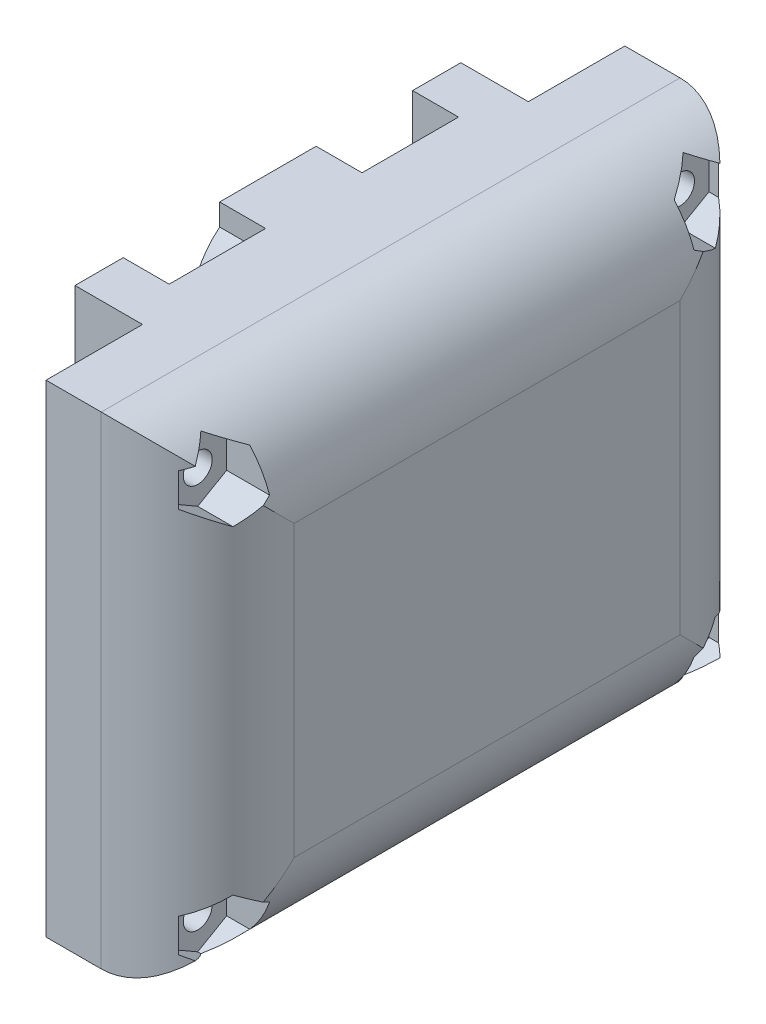
from build123d import *
from build123d.topology import SkipClean

# Parameters (mm, degrees)
CROQUIS1_W              = 60
CROQUIS1_H              = 50
CROQUIS1_R              = 1.5
SALIENTE_EXTRUIR1_DEPTH = 17.96
SALIENTE_EXTRUIR2_START = 4.7625
CROQUIS3_W              = 15
CROQUIS3_H              = 50
CROQUIS3_R              = 1.5
SALIENTE_EXTRUIR2_DEPTH = 4.7625
SALIENTE_EXTRUIR3_DEPTH = 4.7625
REDONDEO2_R             = 10
CORTAR_EXTRUIR1_DEPTH   = 5
CROQUIS6_W              = 10
CROQUIS6_H              = 50
CORTAR_EXTRUIR2_DEPTH   = 7


with BuildPart() as part:
    # Croquis1 → Saliente-Extruir1 (new body)
    with BuildSketch(Plane(origin=(0, 0, 0), x_dir=(0, 0, -1), z_dir=(1, 0, 0))):
        Rectangle(CROQUIS1_W, CROQUIS1_H)
        with Locations((-25, 20)):
            Circle(CROQUIS1_R, mode=Mode.SUBTRACT)
        with Locations(Location((25, 20, 0), (0, 0, 180))):
            Circle(CROQUIS1_R, mode=Mode.SUBTRACT)
        with Locations((25, -20)):
            Circle(CROQUIS1_R, mode=Mode.SUBTRACT)
        with Locations(Location((-25, -20, 0), (0, 0, 180))):
            Circle(CROQUIS1_R, mode=Mode.SUBTRACT)
    extrude(amount=SALIENTE_EXTRUIR1_DEPTH)

    # Croquis3 → Saliente-Extruir2 (add)
    # profile 1 of 2: a face of its own
    with SkipClean():  # the faces are left unmerged after this step: merging them gives an invalid solid
        with BuildSketch(Plane.ZY.offset(SALIENTE_EXTRUIR2_START)):
            with Locations((-22.5, 0)):
                Rectangle(CROQUIS3_W, CROQUIS3_H)
            with Locations((-25, -20)):
                Circle(CROQUIS3_R, mode=Mode.SUBTRACT)
            with Locations((-25, 20)):
                Circle(CROQUIS3_R, mode=Mode.SUBTRACT)
        # profile 2 of 2: a face of its own
        with BuildSketch(Plane.ZY.offset(SALIENTE_EXTRUIR2_START)):
            with Locations((22.5, 0)):
                Rectangle(CROQUIS3_W, CROQUIS3_H)
            with Locations((25, -20)):
                Circle(CROQUIS3_R, mode=Mode.SUBTRACT)
            with Locations((25, 20)):
                Circle(CROQUIS3_R, mode=Mode.SUBTRACT)
        extrude(amount=-SALIENTE_EXTRUIR2_DEPTH)

    # Croquis4 → Saliente-Extruir3 (add)
    with SkipClean():  # the faces are left unmerged after this step: merging them gives an invalid solid
        with BuildSketch(Plane.ZY):
            with BuildLine():
                Line((-5, 22.744997998), (-5, 25))
                Line((-5, 25), (5, 25))
                Line((5, 25), (5, 22.744997998))
                ThreePointArc((5, 22.744997998), (0, 8.5), (-5, 22.744997998))
            make_face()
            with BuildLine():
                Line((-5, -22.744997998), (-5, -25))
                Line((-5, -25), (5, -25))
                Line((5, -25), (5, -22.744997998))
                ThreePointArc((5, -22.744997998), (0, -8.5), (-5, -22.744997998))
            make_face()
        extrude(amount=SALIENTE_EXTRUIR3_DEPTH)

    # Redondeo2
    # the kernel refuses this fillet: 10 mm, written as the material it takes off along each edge
    with BuildSketch(Plane(origin=(17.96, -50, -30), x_dir=(-1, 0, 0), z_dir=(0, 1, 0)), Plane(origin=(17.96, 50, 30), x_dir=(-1, 0, 0), z_dir=(0, -1, 0))) as redondeo2_piece_1:
        with BuildLine():
            CenterArc((REDONDEO2_R, REDONDEO2_R), REDONDEO2_R, 180, 90)
            Line((0, REDONDEO2_R), (0, 0))
            Line((0, 0), (REDONDEO2_R, 0))
        make_face()
    extrude(amount=100, mode=Mode.SUBTRACT)
    with BuildSketch(Plane(origin=(17.96, 25, -55), x_dir=(0, -1, 0), z_dir=(0, 0, 1))) as redondeo2_piece_2:
        with BuildLine():
            CenterArc((REDONDEO2_R, -REDONDEO2_R), REDONDEO2_R, 90, 90)
            Line((0, -REDONDEO2_R), (0, 0))
            Line((0, 0), (REDONDEO2_R, 0))
        make_face()
    extrude(amount=110, mode=Mode.SUBTRACT)
    with BuildSketch(Plane(origin=(17.96, -25, 55), x_dir=(-1, 0, 0), z_dir=(0, 0, -1))) as redondeo2_piece_3:
        with BuildLine():
            CenterArc((REDONDEO2_R, REDONDEO2_R), REDONDEO2_R, 180, 90)
            Line((0, REDONDEO2_R), (0, 0))
            Line((0, 0), (REDONDEO2_R, 0))
        make_face()
    extrude(amount=110, mode=Mode.SUBTRACT)

    # Croquis5 → Cortar-Extruir1 (cut)
    with BuildSketch(Plane(origin=(17.96, 0, 0), x_dir=(0, 0, -1), z_dir=(1, 0, 0))):
        Polygon((-25, 23.464101615), (-28, 21.732050808), (-28, 18.267949192), (-25, 16.535898385), (-22, 18.267949192), (-22, 21.732050808), align=None)
        Polygon((25, 23.464101615), (22, 21.732050808), (22, 18.267949192), (25, 16.535898385), (28, 18.267949192), (28, 21.732050808), align=None)
        Polygon((25, -16.535898385), (22, -18.267949192), (22, -21.732050808), (25, -23.464101615), (28, -21.732050808), (28, -18.267949192), align=None)
        Polygon((-25, -16.535898385), (-28, -18.267949192), (-28, -21.732050808), (-25, -23.464101615), (-22, -21.732050808), (-22, -18.267949192), align=None)
    extrude(amount=-CORTAR_EXTRUIR1_DEPTH, mode=Mode.SUBTRACT)

    # Croquis6 → Cortar-Extruir2 (cut)
    with BuildSketch(Plane.ZY.offset(4.7625)):
        with Locations((25, 0)):
            Rectangle(CROQUIS6_W, CROQUIS6_H)
        with Locations((-25, 0)):
            Rectangle(CROQUIS6_W, CROQUIS6_H)
    extrude(amount=-CORTAR_EXTRUIR2_DEPTH, mode=Mode.SUBTRACT)


solid = part.part
